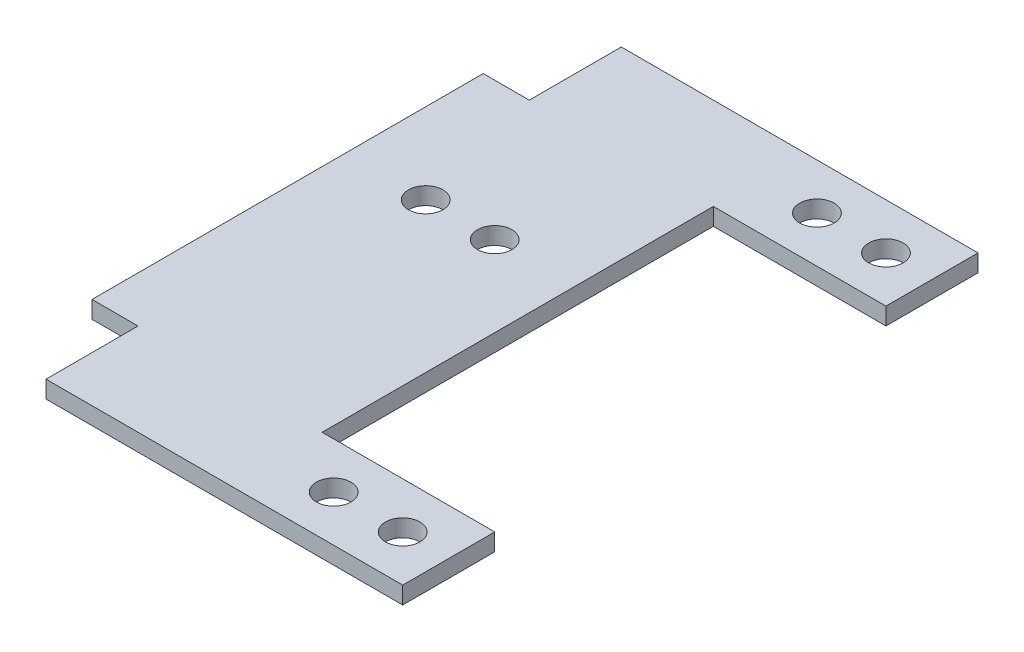
from build123d import *

# Parameters (mm, degrees)
SKETCH1_W          = 20
SKETCH1_H          = 34
BASE_FLANGE1_DEPTH = 1.5
SKETCH2_W          = 31
SKETCH2_H          = 8
TAB1_DEPTH         = 1.5
SKETCH4_R          = 1.5
CUT_EXTRUDE1_DEPTH = 10
SKETCH5_R          = 1.5
CUT_EXTRUDE2_DEPTH = 10


# Sheet-metal steps are written as plain solids
with BuildPart() as part:
    # Sketch1 → Base-Flange1 (new body)
    with BuildSketch(Plane(origin=(0, 0, 0), x_dir=(1, 0, 0), z_dir=(0, 1, 0))):
        Rectangle(SKETCH1_W, SKETCH1_H)
    extrude(amount=BASE_FLANGE1_DEPTH)

    # Sketch2 → Tab1 (add)
    with BuildSketch(Plane(origin=(0, 1.5, 0), x_dir=(1, 0, 0), z_dir=(0, 1, 0))):
        with Locations((9.5, -21)):
            Rectangle(SKETCH2_W, SKETCH2_H)
        with Locations((9.5, 21)):
            Rectangle(SKETCH2_W, SKETCH2_H)
    extrude(amount=-TAB1_DEPTH)

    # Sketch4 → Cut-Extrude1 (cut)
    with BuildSketch(Plane(origin=(0, 1.5, 0), x_dir=(1, 0, 0), z_dir=(0, 1, 0))):
        with Locations(Location((-3, 5, 0), (0, 0, 270))):
            Circle(SKETCH4_R)
        with Locations(Location((3, 5, 0), (0, 0, 270))):
            Circle(SKETCH4_R)
    extrude(amount=-CUT_EXTRUDE1_DEPTH, mode=Mode.SUBTRACT)

    # Sketch5 → Cut-Extrude2 (cut)
    with BuildSketch(Plane(origin=(0, 1.5, 0), x_dir=(1, 0, 0), z_dir=(0, 1, 0))):
        with Locations(Location((21, 21, 0), (0, 0, 270))):
            Circle(SKETCH5_R)
        with Locations(Location((15, 21, 0), (0, 0, 270))):
            Circle(SKETCH5_R)
        with Locations(Location((15, -21, 0), (0, 0, 270))):
            Circle(SKETCH5_R)
        with Locations(Location((21, -21, 0), (0, 0, 270))):
            Circle(SKETCH5_R)
    extrude(amount=-CUT_EXTRUDE2_DEPTH, mode=Mode.SUBTRACT)


solid = part.part
